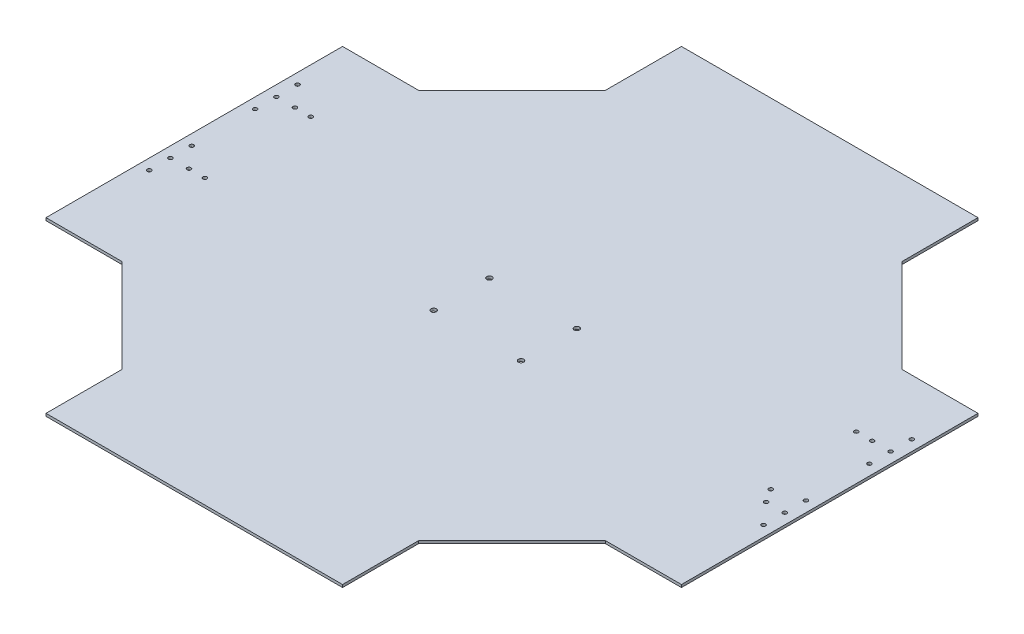
from build123d import *

# Parameters (mm, degrees)
BOSS_EXTRUDE1_DEPTH     = 1.5875
SKETCH2_R               = 2.38125
CUT_EXTRUDE1_DEPTH      = 539.824721616
CUT_EXTRUDE3_DEPTH      = 539.824721616
CUT_EXTRUDE3_DEPTH_BACK = 539.824721616
SKETCH4_R               = 3.175


with BuildPart() as part:
    # Sketch1 → Boss-Extrude1 (new, symmetric)
    with BuildSketch(Plane(origin=(0, 0, 0), x_dir=(1, 0, 0), z_dir=(0, 1, 0))):
        Polygon((-381, 177.8), (-289.71875, 177.8), (-177.8, 289.71875), (-177.8, 381), (177.8, 381), (177.8, 289.71875), (289.71875, 177.8), (381, 177.8), (381, -177.8), (289.71875, -177.8), (177.8, -289.71875), (177.8, -381), (-177.8, -381), (-177.8, -289.71875), (-289.71875, -177.8), (-381, -177.8), align=None)
    extrude(amount=BOSS_EXTRUDE1_DEPTH, both=True)

    # Sketch2 → Cut-Extrude1 (cut, through all)
    with BuildSketch(Plane(origin=(0, 1.5875, 0), x_dir=(1, 0, 0), z_dir=(0, 1, 0))):
        with Locations((-346.075, -41.275)):
            Circle(SKETCH2_R)
        with Locations((-368.3, -41.275)):
            Circle(SKETCH2_R)
        with Locations((-368.3, -15.875)):
            Circle(SKETCH2_R)
        with Locations((-368.3, -66.675)):
            Circle(SKETCH2_R)
        with Locations((368.3, -66.675)):
            Circle(SKETCH2_R)
        with Locations((368.3, -15.875)):
            Circle(SKETCH2_R)
        with Locations((368.3, -41.275)):
            Circle(SKETCH2_R)
        with Locations((346.075, -41.275)):
            Circle(SKETCH2_R)
        with Locations((-327.025, -41.275)):
            Circle(SKETCH2_R)
        with Locations((335.694816505, -25.301450282)):
            Circle(SKETCH2_R)
        with Locations((-346.075, 85.725)):
            Circle(SKETCH2_R)
        with Locations((-368.3, 85.725)):
            Circle(SKETCH2_R)
        with Locations((-368.3, 111.125)):
            Circle(SKETCH2_R)
        with Locations((-368.3, 60.325)):
            Circle(SKETCH2_R)
        with Locations((-327.025, 85.725)):
            Circle(SKETCH2_R)
        with Locations((327.025, 85.725)):
            Circle(SKETCH2_R)
        with Locations((368.3, 60.325)):
            Circle(SKETCH2_R)
        with Locations((368.3, 111.125)):
            Circle(SKETCH2_R)
        with Locations((368.3, 85.725)):
            Circle(SKETCH2_R)
        with Locations((346.075, 85.725)):
            Circle(SKETCH2_R)
    extrude(amount=-CUT_EXTRUDE1_DEPTH, mode=Mode.SUBTRACT)

    # Sketch4 → Cut-Extrude3 (cut, two sides: drawn at the far end of the back side and taken through both)
    with BuildSketch(Plane(origin=(0, 1.5875, 0), x_dir=(1, 0, 0), z_dir=(0, 1, 0)).offset(-CUT_EXTRUDE3_DEPTH_BACK)):
        with Locations((-52.3875, -41.57265625)):
            Circle(SKETCH4_R)
        with Locations((52.3875, -41.57265625)):
            Circle(SKETCH4_R)
        with Locations((-52.3875, 25.30078125)):
            Circle(SKETCH4_R)
        with Locations((52.3875, 25.30078125)):
            Circle(SKETCH4_R)
    extrude(amount=CUT_EXTRUDE3_DEPTH + CUT_EXTRUDE3_DEPTH_BACK, mode=Mode.SUBTRACT)


solid = part.part
